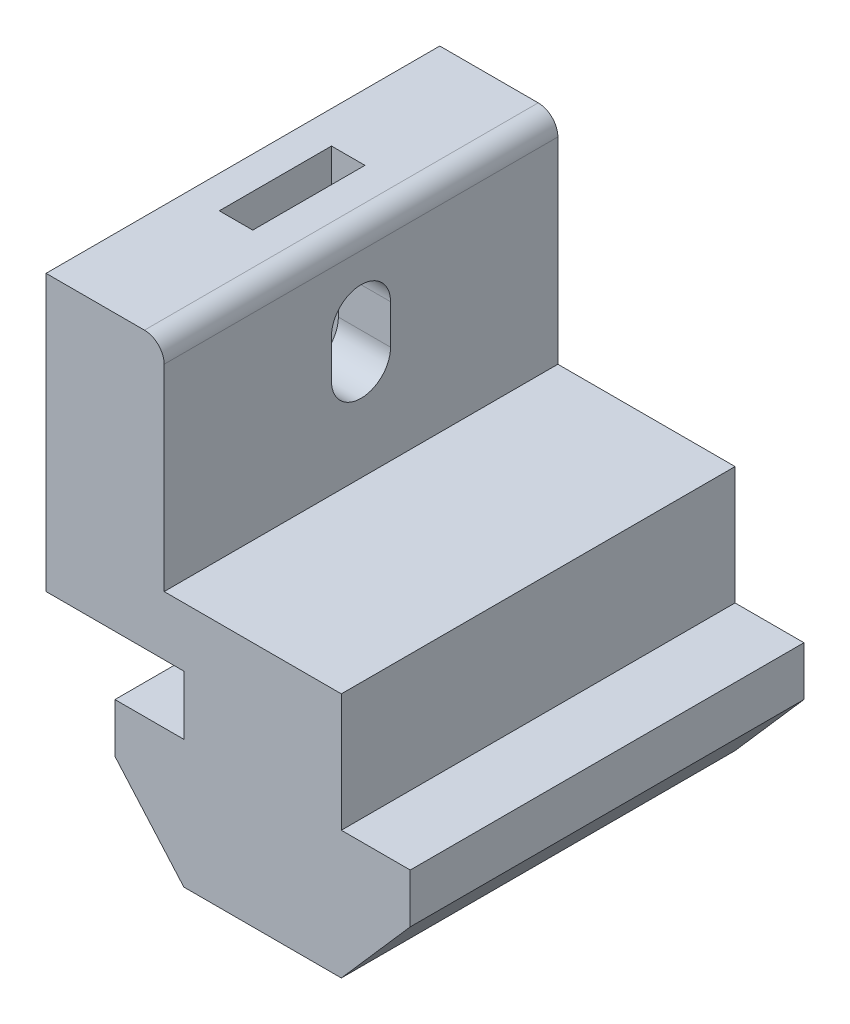
from build123d import *

# Parameters (mm, degrees)
ESTRUSIONE_ESTRUSIONE1_DEPTH = 20
TAGLIO_ESTRUSIONE1_REACH     = 37.979
ESTRUSIONE_ESTRUSIONE4_DEPTH = 0.6
SCHIZZO12_W                  = 1.7
SCHIZZO12_H                  = 5.7
TAGLIO_ESTRUSIONE2_DEPTH     = 10


with BuildPart() as part:
    # Schizzo2 → Estrusione-Estrusione1 (new body)
    with BuildSketch(Plane.XY):
        with BuildLine():
            Line((-4, 9.5), (-11, 9.5))
            Line((-11, 9.5), (-11, 23.5))
            Line((-11, 23.5), (-6, 23.5))
            ThreePointArc((-6, 23.5), (-5.292893219, 23.207106781), (-5, 22.5))
            Line((-5, 22.5), (-5, 12.5))
            Line((-5, 12.5), (4, 12.5))
            Line((4, 12.5), (4, 9.5))
            Line((4, 9.5), (4, 6.5))
            Line((4, 6.5), (7.5, 6.5))
            Line((7.5, 6.5), (7.5, 4))
            Line((7.5, 4), (4, 0))
            Line((4, 0), (-4, 0))
            Line((-4, 0), (-7.5, 4))
            Line((-7.5, 4), (-7.5, 6.5))
            Line((-7.5, 6.5), (-4, 6.5))
            Line((-4, 6.5), (-4, 9.5))
        make_face()
    extrude(amount=-ESTRUSIONE_ESTRUSIONE1_DEPTH)

    # Schizzo6 → Taglio-Estrusione1 (cut, up to next)
    with BuildSketch(Plane.ZY.offset(11), mode=Mode.PRIVATE) as taglio_estrusione1_sk1:
        with BuildLine():
            Line((-8.5, 19.5), (-8.5, 17.5))
            ThreePointArc((-8.5, 17.5), (-10, 16), (-11.5, 17.5))
            Line((-11.5, 17.5), (-11.5, 19.5))
            ThreePointArc((-11.5, 19.5), (-10, 21), (-8.5, 19.5))
        make_face()
    taglio_estrusione1_tool1 = extrude(taglio_estrusione1_sk1.sketch, amount=-TAGLIO_ESTRUSIONE1_REACH, mode=Mode.PRIVATE) & part.part
    add(taglio_estrusione1_tool1.solids().sort_by_distance((-11, 18.5, -10))[0], mode=Mode.SUBTRACT)

    # Schizzo11 → Estrusione-Estrusione4 (add)
    with BuildSketch(Plane(origin=(0, 0, -20), x_dir=(-1, 0, 0), z_dir=(0, 0, -1))):
        with BuildLine():
            Line((-1.916666667, 6), (-2.5, 6))
            add(Edge.make_bspline(
                [(-2.5, 6), (-2.484196549, 6.065431756), (-2.453302094, 6.193345487), (-2.388863743, 6.376101829), (-2.318665127, 6.549045511), (-2.234371075, 6.708938219), (-2.142426246, 6.858993324), (-2.037084049, 6.995807413), (-1.923204564, 7.122860063), (-1.797243944, 7.235613218), (-1.665147858, 7.337714716), (-1.525054993, 7.424768393), (-1.379783905, 7.499656106), (-1.228328086, 7.561350822), (-1.070236625, 7.607826795), (-0.906938753, 7.641546577), (-0.738006538, 7.66344436), (-0.623332441, 7.665581492), (-0.565104167, 7.666666667)],
                knots=[0, 0, 0, 0, 1.162005537, 2.271625781, 3.343758855, 4.383309926, 5.390229558, 6.379919256, 7.361854164, 8.333198761, 9.295911338, 10.242430842, 11.177959212, 12.116337295, 13.062827104, 14.020064771, 14.994644689, 16, 16, 16, 16], degree=3))
            add(Edge.make_bspline(
                [(-0.565104167, 7.666666667), (-0.480264789, 7.664105239), (-0.312436625, 7.659038256), (-0.065876681, 7.612768588), (0.171887412, 7.539550485), (0.398253158, 7.438384992), (0.608515961, 7.313608553), (0.795597451, 7.165102613), (0.956961828, 6.995732482), (1.092337101, 6.80865772), (1.198333527, 6.608726059), (1.276493935, 6.402954339), (1.324077057, 6.191830678), (1.330243806, 6.049281445), (1.333333333, 5.977864583)],
                knots=[0, 0, 0, 0, 1.083050992, 2.142477498, 3.193116406, 4.255571735, 5.30263384, 6.308962982, 7.297363603, 8.282367274, 9.249857812, 10.179914175, 11.08814088, 12, 12, 12, 12], degree=3))
            add(Edge.make_bspline(
                [(1.333333333, 5.977864583), (1.331172379, 5.909137679), (1.326943725, 5.774649792), (1.291038272, 5.578309869), (1.230613784, 5.393261183), (1.146912796, 5.218724739), (1.038564203, 5.055807179), (0.907314909, 4.904141953), (0.752238537, 4.763056374), (0.634720509, 4.682234495), (0.57421875, 4.640625)],
                knots=[0, 0, 0, 0, 1.024540389, 2.004866551, 2.965041327, 3.920577974, 4.882998113, 5.874504559, 6.905732034, 8, 8, 8, 8], degree=3))
            add(Edge.make_bspline(
                [(0.57421875, 4.640625), (0.643363437, 4.607236967), (0.780359061, 4.541085617), (0.967095758, 4.411353496), (1.136611813, 4.261563137), (1.231147291, 4.144669639), (1.278645833, 4.0859375)],
                knots=[0, 0, 0, 0, 1.015518401, 2.012035669, 3.001164323, 4, 4, 4, 4], degree=3))
            add(Edge.make_bspline(
                [(1.278645833, 4.0859375), (1.309922612, 4.043115961), (1.37196399, 3.958174116), (1.448544267, 3.821606468), (1.518018337, 3.683525131), (1.572154458, 3.540229091), (1.614077354, 3.393379209), (1.644044271, 3.24272333), (1.662660533, 3.088138431), (1.665326558, 2.983558111), (1.666666667, 2.930989583)],
                knots=[0, 0, 0, 0, 1.025084078, 2.033381695, 3.024893161, 4.013698104, 4.991890475, 5.976764909, 6.982997093, 8, 8, 8, 8], degree=3))
            add(Edge.make_bspline(
                [(1.666666667, 2.930989583), (1.663333999, 2.83997153), (1.656684346, 2.658363755), (1.597248208, 2.390053558), (1.505109333, 2.127777625), (1.374260737, 1.876924352), (1.214792507, 1.64221793), (1.025071762, 1.43221907), (0.807254146, 1.251707377), (0.56432937, 1.100888382), (0.301140417, 0.980326526), (0.019642889, 0.896648418), (-0.276107211, 0.842148704), (-0.478920764, 0.836304519), (-0.58203125, 0.833333333)],
                knots=[0, 0, 0, 0, 0.955779014, 1.907060117, 2.875433937, 3.871313158, 4.872415639, 5.851225146, 6.836215519, 7.83643374, 8.849228613, 9.86973379, 10.916971861, 12, 12, 12, 12], degree=3))
            add(Edge.make_bspline(
                [(-0.58203125, 0.833333333), (-0.651524236, 0.834945729), (-0.78826326, 0.838118387), (-0.9892869, 0.859807218), (-1.181170056, 0.899420085), (-1.364172166, 0.952726223), (-1.538455805, 1.020310887), (-1.703489143, 1.104474184), (-1.860287517, 1.203481259), (-2.007371283, 1.318500779), (-2.144722909, 1.447166124), (-2.268692254, 1.591761428), (-2.381346155, 1.74961375), (-2.479668199, 1.922556569), (-2.568136825, 2.108354904), (-2.640901459, 2.309387829), (-2.704946086, 2.523858156), (-2.73472252, 2.673316816), (-2.75, 2.75)],
                knots=[0, 0, 0, 0, 1.048658725, 2.063410685, 3.046034179, 4.001477787, 4.936774919, 5.862367409, 6.792675028, 7.730719943, 8.675894397, 9.627829632, 10.600096036, 11.597688215, 12.626045268, 13.701542398, 14.82072376, 16, 16, 16, 16], degree=3))
            Line((-2.75, 2.75), (-2.166666667, 2.75))
            add(Edge.make_bspline(
                [(-2.166666667, 2.75), (-2.151469125, 2.699951833), (-2.121908588, 2.602603799), (-2.071590606, 2.462500375), (-2.014263815, 2.33406399), (-1.952765349, 2.216352478), (-1.888176806, 2.108206588), (-1.815906231, 2.012485974), (-1.74130639, 1.924986312), (-1.685073305, 1.875689176), (-1.657552083, 1.8515625)],
                knots=[0, 0, 0, 0, 1.198163088, 2.33053128, 3.407730985, 4.417276592, 5.372219308, 6.28897303, 7.162600585, 8, 8, 8, 8], degree=3))
            add(Edge.make_bspline(
                [(-1.657552083, 1.8515625), (-1.621158441, 1.823504166), (-1.548483496, 1.767474107), (-1.430056781, 1.695971082), (-1.305507707, 1.634014892), (-1.172137598, 1.586688029), (-1.032824452, 1.54661523), (-0.885316488, 1.520391409), (-0.730915085, 1.502399091), (-0.625489239, 1.500811361), (-0.571614583, 1.5)],
                knots=[0, 0, 0, 0, 0.946170439, 1.889420265, 2.845303464, 3.807233317, 4.801018734, 5.828864929, 6.890507805, 8, 8, 8, 8], degree=3))
            add(Edge.make_bspline(
                [(-0.571614583, 1.5), (-0.51078665, 1.501143824), (-0.391842877, 1.503380473), (-0.218283853, 1.523949643), (-0.053170021, 1.553906125), (0.101665412, 1.600173093), (0.24825064, 1.657337532), (0.384530847, 1.729113142), (0.512295044, 1.813324768), (0.629906797, 1.909040348), (0.735662739, 2.013823125), (0.828778978, 2.123418828), (0.907939064, 2.237365369), (0.97179428, 2.356293307), (1.022216731, 2.479710161), (1.056542675, 2.607962273), (1.080409774, 2.740000053), (1.082353483, 2.829753852), (1.083333333, 2.875)],
                knots=[0, 0, 0, 0, 1.217147791, 2.380027433, 3.494444702, 4.572153297, 5.609568379, 6.639424714, 7.649109417, 8.668170816, 9.669597737, 10.625200337, 11.543417969, 12.441394052, 13.322311151, 14.205496177, 15.095365482, 16, 16, 16, 16], degree=3))
            add(Edge.make_bspline(
                [(1.083333333, 2.875), (1.080491345, 2.935563915), (1.074821509, 3.056390388), (1.031534147, 3.234151597), (0.960333399, 3.405423649), (0.860655878, 3.567284402), (0.739318097, 3.71729679), (0.597497555, 3.851143829), (0.43401656, 3.961588284), (0.283551089, 4.037895789), (0.150272941, 4.089964642), (0.036215798, 4.124646719), (-0.091475036, 4.154014937), (-0.231255399, 4.181337727), (-0.384178515, 4.204591659), (-0.5500779, 4.223983603), (-0.728987171, 4.239500107), (-0.852842194, 4.246429284), (-0.916666667, 4.25)],
                knots=[0, 0, 0, 0, 1.07054697, 2.135767047, 3.216561865, 4.33974944, 5.486079747, 6.621378074, 7.775625952, 8.963672916, 9.598146892, 10.304877434, 11.070270905, 11.915000392, 12.823868403, 13.805723172, 14.86925407, 16, 16, 16, 16], degree=3))
            Line((-0.916666667, 4.25), (-0.916666667, 4.916666667))
            add(Edge.make_bspline(
                [(-0.916666667, 4.916666667), (-0.836250216, 4.918031302), (-0.678734144, 4.920704288), (-0.448644721, 4.95303345), (-0.228622855, 4.997754616), (-0.02354462, 5.066255688), (0.163374419, 5.145816239), (0.325539394, 5.238398914), (0.460678382, 5.34131202), (0.568134658, 5.456144008), (0.648974654, 5.579300525), (0.708081563, 5.707660032), (0.742996455, 5.842347574), (0.747657265, 5.934266243), (0.75, 5.98046875)],
                knots=[0, 0, 0, 0, 1.321986639, 2.589447074, 3.816329219, 5.01088745, 6.139805852, 7.153945165, 8.075214402, 8.924034688, 9.728124013, 10.488707548, 11.240355623, 12, 12, 12, 12], degree=3))
            add(Edge.make_bspline(
                [(0.75, 5.98046875), (0.74923038, 6.014413134), (0.747699256, 6.081943876), (0.728390026, 6.180604717), (0.69937395, 6.276249331), (0.659483024, 6.368470979), (0.606089798, 6.456630059), (0.542192966, 6.541478178), (0.466109351, 6.622530911), (0.37892495, 6.698080076), (0.285303026, 6.770080088), (0.182696301, 6.831205413), (0.074198534, 6.883474814), (-0.040310397, 6.926578176), (-0.161202096, 6.959002568), (-0.28790856, 6.982283416), (-0.420671401, 6.996839061), (-0.511247475, 6.99893469), (-0.557291667, 7)],
                knots=[0, 0, 0, 0, 0.884392785, 1.759457502, 2.611959086, 3.489218968, 4.37281399, 5.2945488, 6.255912374, 7.266815255, 8.301784654, 9.332968512, 10.37626691, 11.440494194, 12.520033166, 13.637162961, 14.798855837, 16, 16, 16, 16], degree=3))
            add(Edge.make_bspline(
                [(-0.557291667, 7), (-0.631301907, 6.997416042), (-0.775861121, 6.992368971), (-0.984260252, 6.948163375), (-1.177996158, 6.877632648), (-1.326082253, 6.793442755), (-1.435435605, 6.710334806), (-1.51357849, 6.637753232), (-1.590316581, 6.557092273), (-1.660601409, 6.463383862), (-1.731681652, 6.362974109), (-1.79639298, 6.2507587), (-1.859275266, 6.129664825), (-1.897165715, 6.044058647), (-1.916666667, 6)],
                knots=[0, 0, 0, 0, 1.472543308, 2.876219568, 4.221790263, 5.565193594, 6.249813518, 6.953379497, 7.687249741, 8.463570142, 9.283606569, 10.136032583, 11.040678096, 12, 12, 12, 12], degree=3))
        make_face()
    extrude(amount=ESTRUSIONE_ESTRUSIONE4_DEPTH)

    # Schizzo12 → Taglio-Estrusione2 (cut)
    with BuildSketch(Plane(origin=(0, 23.5, 0), x_dir=(1, 0, 0), z_dir=(0, 1, 0))):
        with Locations((-8.5, 10)):
            Rectangle(SCHIZZO12_W, SCHIZZO12_H)
    extrude(amount=-TAGLIO_ESTRUSIONE2_DEPTH, mode=Mode.SUBTRACT)


solid = part.part
